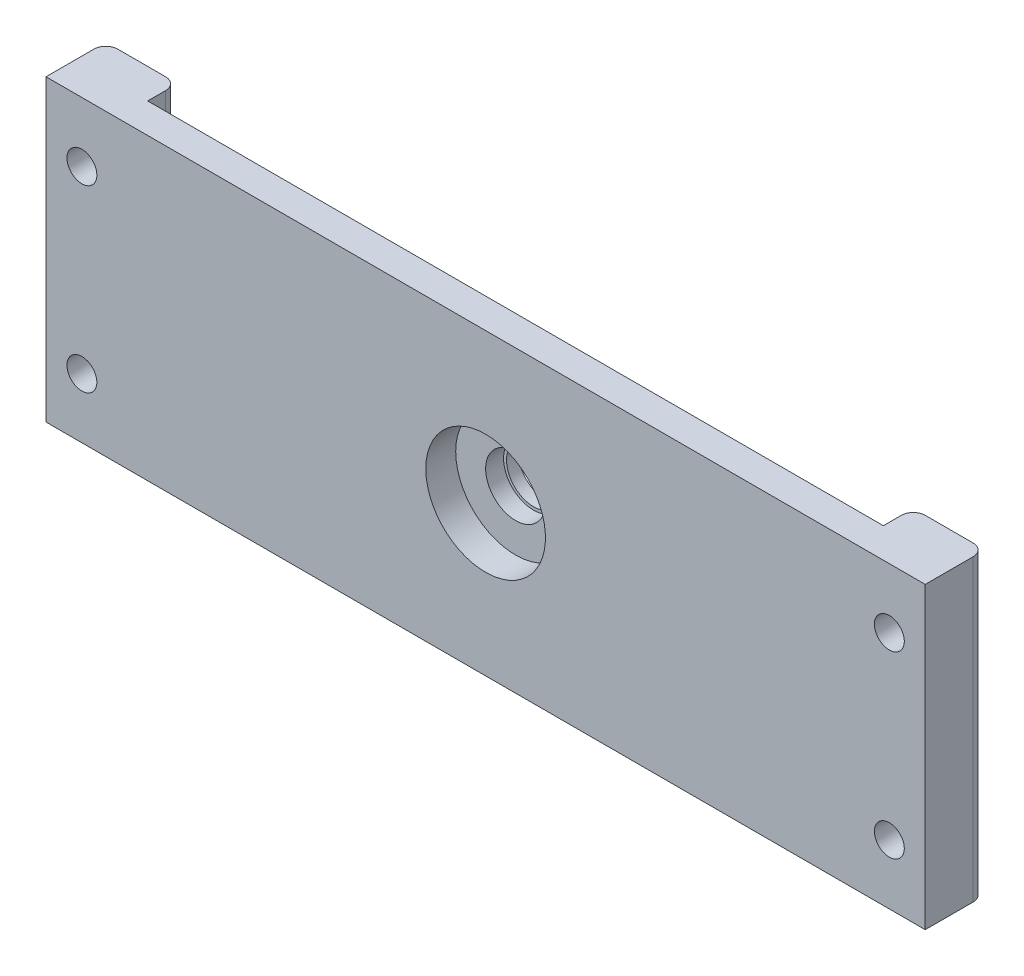
from build123d import *

# Parameters (mm, degrees)
CROQUIS1_W                 = 147
CROQUIS1_H                 = 50
SALIENTE_EXTRUIR1_DEPTH    = 5
CORTAR_EXTRUIR1_DEPTH      = 78.796208134
CORTAR_EXTRUIR1_DEPTH_BACK = 78.796208134
CROQUIS2_R                 = 10
CROQUIS3_R                 = 11
CROQUIS3_R_2               = 5
SALIENTE_EXTRUIR2_DEPTH    = 5
REDONDEO1_R                = 3
CROQUIS4_R                 = 5
CROQUIS4_R_2               = 4.5
SALIENTE_EXTRUIR3_DEPTH    = 2
CROQUIS5_W                 = 12
CROQUIS5_H                 = 50
SALIENTE_EXTRUIR4_DEPTH    = 5
CORTAR_EXTRUIR2_DEPTH      = 79.276752615
CORTAR_EXTRUIR2_DEPTH_BACK = 6
CROQUIS6_R                 = 4.25
CROQUIS7_R                 = 2.5
CORTAR_EXTRUIR3_DEPTH      = 78.866873573
REDONDEO2_R                = 2


with BuildPart() as part:
    # Croquis1 → Saliente-Extruir1 (new body)
    with BuildSketch(Plane.XY):
        Rectangle(CROQUIS1_W, CROQUIS1_H)
    extrude(amount=SALIENTE_EXTRUIR1_DEPTH)

    # Croquis2 → Cortar-Extruir1 (cut, two sides: drawn at the far end of the back side and taken through both)
    with BuildSketch(Plane(origin=(0, 0, 0), x_dir=(-1, 0, 0), z_dir=(0, 0, -1)).offset(-CORTAR_EXTRUIR1_DEPTH_BACK)):
        Circle(CROQUIS2_R)
    extrude(amount=CORTAR_EXTRUIR1_DEPTH + CORTAR_EXTRUIR1_DEPTH_BACK, mode=Mode.SUBTRACT)

    # Croquis3 → Saliente-Extruir2 (add)
    with BuildSketch(Plane(origin=(0, 0, 0), x_dir=(-1, 0, 0), z_dir=(0, 0, -1))):
        Circle(CROQUIS3_R)
        Circle(CROQUIS3_R_2, mode=Mode.SUBTRACT)
    extrude(amount=SALIENTE_EXTRUIR2_DEPTH)

    # Redondeo1
    redondeo1_edges = [part.edges().sort_by_distance(p)[0] for p in [
        (11, 0, -5),
    ]]
    fillet(redondeo1_edges, radius=REDONDEO1_R)

    # Croquis5 → Saliente-Extruir4 (add)
    with BuildSketch(Plane(origin=(0, 0, 0), x_dir=(-1, 0, 0), z_dir=(0, 0, -1))):
        with Locations((-67.5, 0)):
            Rectangle(CROQUIS5_W, CROQUIS5_H)
        with Locations((67.5, 0)):
            Rectangle(CROQUIS5_W, CROQUIS5_H)
    extrude(amount=SALIENTE_EXTRUIR4_DEPTH)

    # Croquis6 → Cortar-Extruir2 (cut, two sides: drawn at the far end of the back side and taken through both)
    with BuildSketch(Plane(origin=(0, 0, -5), x_dir=(-1, 0, 0), z_dir=(0, 0, -1)).offset(-CORTAR_EXTRUIR2_DEPTH_BACK)):
        with Locations(Location((67.5, 15, 0), (0, 0, 180))):
            Circle(CROQUIS6_R)
        with Locations(Location((67.5, -15, 0), (0, 0, 180))):
            Circle(CROQUIS6_R)
        with Locations(Location((-67.5, -15, 0), (0, 0, 180))):
            Circle(CROQUIS6_R)
        with Locations(Location((-67.5, 15, 0), (0, 0, 180))):
            Circle(CROQUIS6_R)
    extrude(amount=CORTAR_EXTRUIR2_DEPTH + CORTAR_EXTRUIR2_DEPTH_BACK, mode=Mode.SUBTRACT)

    # Croquis7 → Cortar-Extruir3 (cut, through all)
    with BuildSketch(Plane(origin=(0, 0, 1), x_dir=(-1, 0, 0), z_dir=(0, 0, -1))):
        with Locations((-67.5, 15)):
            Circle(CROQUIS7_R)
        with Locations((67.5, 15)):
            Circle(CROQUIS7_R)
        with Locations((67.5, -15)):
            Circle(CROQUIS7_R)
        with Locations((-67.5, -15)):
            Circle(CROQUIS7_R)
    extrude(amount=-CORTAR_EXTRUIR3_DEPTH, mode=Mode.SUBTRACT)

    # Redondeo2
    # the kernel refuses this fillet: 2 mm, written as the material it takes off along each edge
    with BuildSketch(Plane(origin=(73.5, -30, -5), x_dir=(0, 0, 1), z_dir=(0, 1, 0)), Plane(origin=(61.5, 30, -5), x_dir=(0, 0, 1), z_dir=(0, -1, 0)), Plane(origin=(-61.5, -30, -5), x_dir=(0, 0, 1), z_dir=(0, 1, 0))) as redondeo2_piece_1:
        with BuildLine():
            CenterArc((REDONDEO2_R, -REDONDEO2_R), REDONDEO2_R, 90, 90)
            Line((0, -REDONDEO2_R), (0, 0))
            Line((0, 0), (REDONDEO2_R, 0))
        make_face()
    extrude(amount=60, mode=Mode.SUBTRACT)
    with BuildSketch(Plane(origin=(-73.5, 30, -5), x_dir=(1, 0, 0), z_dir=(0, -1, 0))) as redondeo2_piece_2:
        with BuildLine():
            CenterArc((REDONDEO2_R, REDONDEO2_R), REDONDEO2_R, 180, 90)
            Line((0, REDONDEO2_R), (0, 0))
            Line((0, 0), (REDONDEO2_R, 0))
        make_face()
    extrude(amount=60, mode=Mode.SUBTRACT)


with BuildPart() as body_2:
    # Croquis4 → Saliente-Extruir3 (new body)
    with BuildSketch(Plane(origin=(0, 0, -5), x_dir=(-1, 0, 0), z_dir=(0, 0, -1))):
        Circle(CROQUIS4_R)
        Circle(CROQUIS4_R_2, mode=Mode.SUBTRACT)
    extrude(amount=-SALIENTE_EXTRUIR3_DEPTH)


solid = Compound([part.part, body_2.part])
